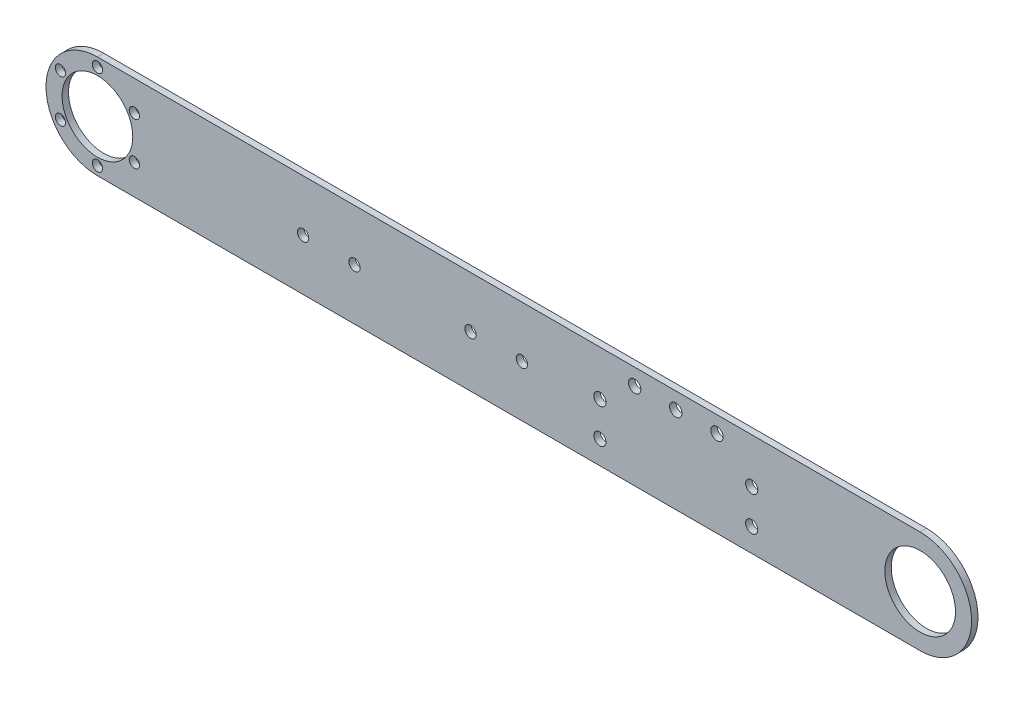
from build123d import *

# Parameters (mm, degrees)
BOSS_EXTRUDE1_DEPTH    = 3.175
SKETCH2_R              = 17.4625
CUT_EXTRUDE1_DEPTH     = 435.789559011
F_10_CLEARANCE_HOLE1_D = 5.1054
SKETCH4_R              = 2.794
CUT_EXTRUDE2_DEPTH     = 435.789559011
SKETCH7_R              = 3.048
CUT_EXTRUDE3_DEPTH     = 435.789559011
SKETCH8_R              = 3
CUT_EXTRUDE4_DEPTH     = 435.789559011


with BuildPart() as part:
    # Sketch1 → Boss-Extrude1 (new body)
    with BuildSketch(Plane.XY):
        with BuildLine():
            Line((0, 0), (406.4, 0))
            ThreePointArc((406.4, 0), (431.8, 25.4), (406.4, 50.8))
            Line((406.4, 50.8), (0, 50.8))
            ThreePointArc((0, 50.8), (-25.4, 25.4), (0, 0))
        make_face()
    extrude(amount=BOSS_EXTRUDE1_DEPTH)

    # Sketch2 → Cut-Extrude1 (cut, through all)
    with BuildSketch(Plane.XY.offset(3.175)):
        with Locations((0, 25.4)):
            Circle(SKETCH2_R)
        with Locations((406.4, 25.4)):
            Circle(SKETCH2_R)
    extrude(amount=-CUT_EXTRUDE1_DEPTH, mode=Mode.SUBTRACT)

    # #10 Clearance Hole1 (through all)
    with Locations(Plane(origin=(18.257547563, 35.941, 3.175), x_dir=(1, 0, 0), z_dir=(0, 0, 1))):
        with Locations((0, 0), (0, -21.082), (-18.257547563, -31.623), (-36.515095126, -21.082), (-36.515095126, 0), (-18.257547563, 10.541)):
            Hole(F_10_CLEARANCE_HOLE1_D / 2)

    # Sketch4 → Cut-Extrude2 (cut, through all)
    with BuildSketch(Plane.XY.offset(3.175)):
        with Locations((101.6, 25.4)):
            Circle(SKETCH4_R)
        with Locations((127, 25.4)):
            Circle(SKETCH4_R)
        with Locations((184.272931293, 25.4)):
            Circle(SKETCH4_R)
        with Locations((209.672931293, 25.4)):
            Circle(SKETCH4_R)
    extrude(amount=-CUT_EXTRUDE2_DEPTH, mode=Mode.SUBTRACT)

    # Sketch7 → Cut-Extrude3 (cut, through all)
    with BuildSketch(Plane.XY.offset(3.175)):
        with Locations((306.015176825, 42.672)):
            Circle(SKETCH7_R)
        with Locations((285.695176825, 42.672)):
            Circle(SKETCH7_R)
        with Locations((265.375176825, 42.672)):
            Circle(SKETCH7_R)
    extrude(amount=-CUT_EXTRUDE3_DEPTH, mode=Mode.SUBTRACT)

    # Sketch8 → Cut-Extrude4 (cut, through all)
    with BuildSketch(Plane.XY.offset(3.175)):
        with Locations((323.195176825, 11.543289628)):
            Circle(SKETCH8_R)
        with Locations((323.195176825, 28.543289628)):
            Circle(SKETCH8_R)
        with Locations((248.195176825, 11.543289628)):
            Circle(SKETCH8_R)
        with Locations((248.195176825, 28.543289628)):
            Circle(SKETCH8_R)
    extrude(amount=-CUT_EXTRUDE4_DEPTH, mode=Mode.SUBTRACT)


solid = part.part
